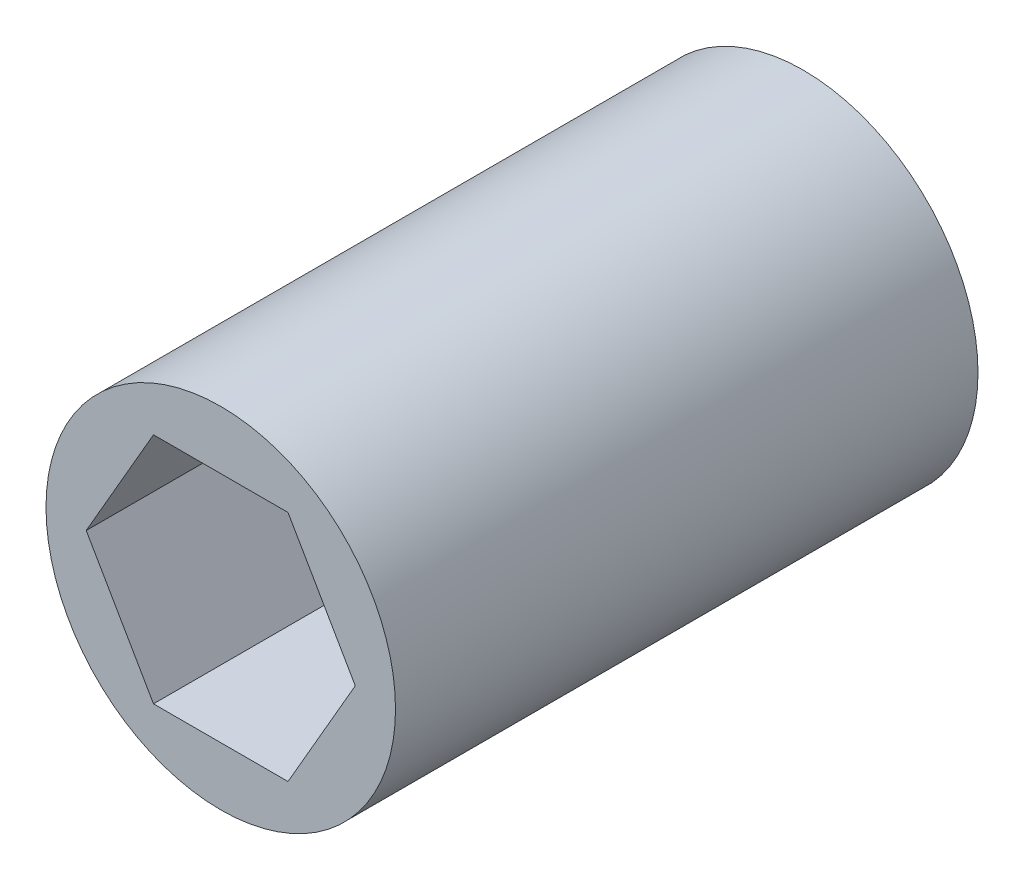
from build123d import *

# Parameters (mm, degrees)
SKETCH1_R           = 9.525
BOSS_EXTRUDE1_DEPTH = 31.75


with BuildPart() as part:
    # Sketch1 → Boss-Extrude1 (new body)
    with BuildSketch(Plane.XY):
        Circle(SKETCH1_R)
        Polygon((-3.666174209, 6.35), (-7.332348419, 0), (-3.666174209, -6.35), (3.666174209, -6.35), (7.332348419, 0), (3.666174209, 6.35), align=None, mode=Mode.SUBTRACT)
    extrude(amount=BOSS_EXTRUDE1_DEPTH)


solid = part.part
